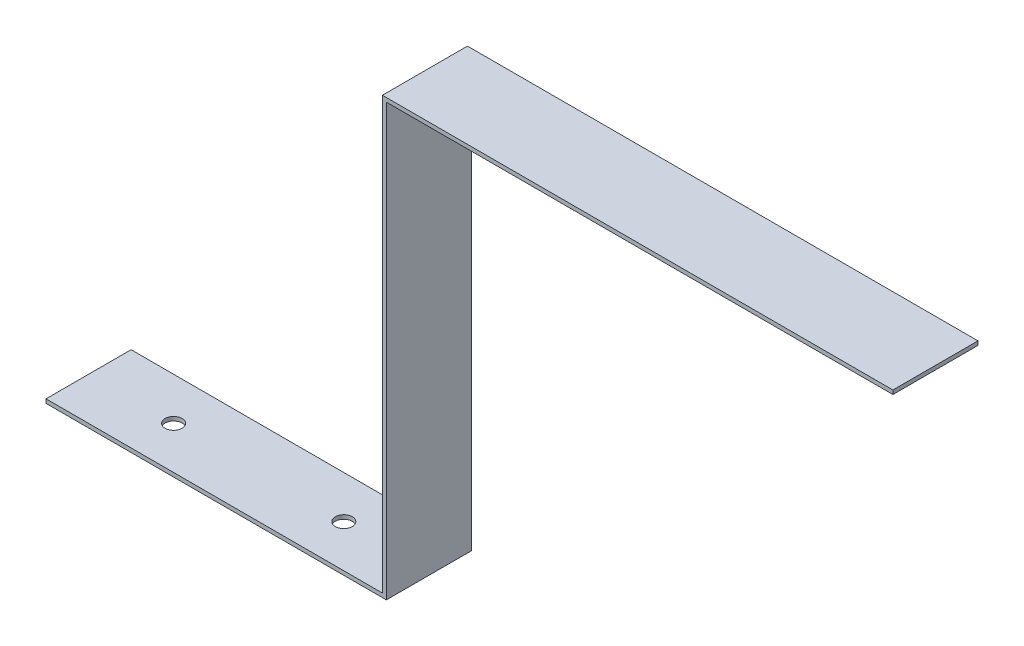
from build123d import *

# Parameters (mm, degrees)
BOSS_EXTRUDE1_DEPTH = 15
SKETCH2_R           = 1.5
CUT_EXTRUDE1_DEPTH  = 169.200743161


with BuildPart() as part:
    # Sketch1 → Boss-Extrude1 (new body)
    with BuildSketch(Plane.XY):
        Polygon((0, 0), (60, 0), (60, 76), (149.3, 76), (149.3, 76.7), (59.3, 76.7), (59.3, 0.7), (0, 0.7), align=None)
    extrude(amount=BOSS_EXTRUDE1_DEPTH)

    # Sketch2 → Cut-Extrude1 (cut, through all)
    with BuildSketch(Plane(origin=(0, 0.7, 0), x_dir=(1, 0, 0), z_dir=(0, 1, 0))):
        with Locations((15, -7.5)):
            Circle(SKETCH2_R)
        with Locations((45, -7.5)):
            Circle(SKETCH2_R)
    extrude(amount=-CUT_EXTRUDE1_DEPTH, mode=Mode.SUBTRACT)


solid = part.part
